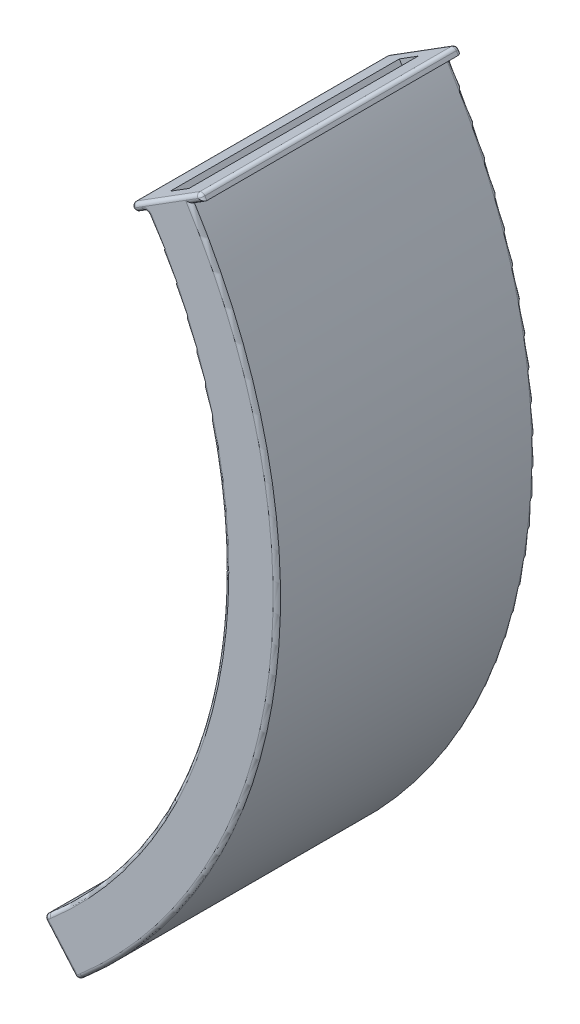
from build123d import *

# Parameters (mm, degrees)
SKETCH10_W          = 3.5
SKETCH10_H          = 17.5
SHELL1_T            = -1
SKETCH11_W          = 5.5
SKETCH11_H          = 17.5
SKETCH11_W_2        = 1.5
SKETCH11_H_2        = 15.5
BOSS_EXTRUDE1_DEPTH = 0.5
SKETCH12_W          = 15.5
SKETCH12_H          = 0.35
SKETCH12_W_2        = 1
SKETCH12_H_2        = 0.8
BOSS_EXTRUDE2_DEPTH = 0.5
FILLET1_R           = 0.25


with BuildPart() as part:
    # Sweep1: sweep along a path in Sketch7
    with BuildLine(Plane.XY) as sweep1_path:
        ThreePointArc((11.723892809, 0.886599981), (16.638600451, -22.580062041), (5.082270205, -43.586961119))
    # Sketch10 → Sweep1 (sweep)
    with BuildSketch(Plane(origin=(0, -17.481848747, 0), x_dir=(1, 0, 0), z_dir=(0, 1, 0))):
        with Locations((18.767181512, 0)):
            Rectangle(SKETCH10_W, SKETCH10_H)
    sweep(path=sweep1_path.line)

    # Shell1
    shell1_openings = [part.faces().sort_by_distance(p)[0] for p in [
        (6.227177499, -44.910474357, 0),
        (13.205526307, 1.817869101, 0),
    ]]
    offset(amount=SHELL1_T, openings=shell1_openings, kind=Kind.INTERSECTION)

    # Sketch11 → Boss-Extrude1 (add)
    with BuildSketch(Plane(origin=(2.920606872, -4.646636383, 0), x_dir=(0.8466477136319881, 0.5321537832259836, 0), z_dir=(-0.5321537832259836, 0.8466477136319881, 0))):
        with Locations((12.147814575, 0)):
            Rectangle(SKETCH11_W, SKETCH11_H)
        with Locations((12.147814575, 0)):
            Rectangle(SKETCH11_W_2, SKETCH11_H_2, mode=Mode.SUBTRACT)
    extrude(amount=BOSS_EXTRUDE1_DEPTH)

    # Sketch12 → Boss-Extrude2 (add)
    with BuildSketch(Plane(origin=(-18.659517469, -16.141446142, 0), x_dir=(0, 0, 1), z_dir=(-0.7562932785342891, -0.654232739049229, 0))):
        Polygon((-7.75, -38.439513283), (-8.75, -38.439513283), (-8.75, -39.789513283), (8.75, -39.789513283), (8.75, -38.439513283), (7.75, -38.439513283), (7.75, -38.789513283), (-7.75, -38.789513283), align=None)
        with Locations((0, -38.614513283)):
            Rectangle(SKETCH12_W, SKETCH12_H)
        Polygon((8.75, -36.289513283), (-8.75, -36.289513283), (-8.75, -37.639513283), (-7.75, -37.639513283), (-7.75, -37.289513283), (7.75, -37.289513283), (7.75, -37.639513283), (8.75, -37.639513283), align=None)
        with Locations((0, -37.464513283)):
            Rectangle(SKETCH12_W, SKETCH12_H)
        with Locations((8.25, -38.039513283)):
            Rectangle(SKETCH12_W_2, SKETCH12_H_2)
        with Locations((-8.25, -38.039513283)):
            Rectangle(SKETCH12_W_2, SKETCH12_H_2)
    extrude(amount=BOSS_EXTRUDE2_DEPTH)

    # Fillet1
    fillet1_edges = [part.edges().sort_by_distance(p)[0] for p in [
        (16.638600451, -22.580062041, -8.75),
        (16.638600451, -22.580062041, 8.75),
        (20.100212795, -23.097014635, 8.75),
        (20.100212795, -23.097014635, -8.75),
        (15.267730628, 3.704615862, 0),
        (12.939449416, 2.241192958, -8.75),
        (10.611168203, 0.777770054, 0),
        (12.939449416, 2.241192958, 8.75),
        (15.400769074, 3.492953934, 8.75),
        (15.110483663, 3.015215114, -8.75),
        (11.300568952, 0.620523089, -8.75),
        (15.400769074, 3.492953934, -8.75),
        (10.877245095, 0.354446198, 0),
        (10.744206649, 0.566108126, -8.75),
        (11.300568952, 0.620523089, 8.75),
        (15.110483663, 3.015215114, 8.75),
        (10.744206649, 0.566108126, 8.75),
        (11.723892809, 0.886599981, 0),
        (4.893196886, -43.750519304, 8.75),
        (4.893196886, -43.750519304, -8.75),
        (7.183011472, -46.397545779, -8.75),
        (7.183011472, -46.397545779, 8.75),
        (4.704123566, -43.914077489, 0),
        (5.849030859, -45.237590726, -8.75),
        (6.993938153, -46.561103964, 0),
        (5.849030859, -45.237590726, 8.75),
    ]]
    fillet(fillet1_edges, radius=FILLET1_R - 0.0001)  # a hair under: the kernel refuses the full size


solid = part.part
